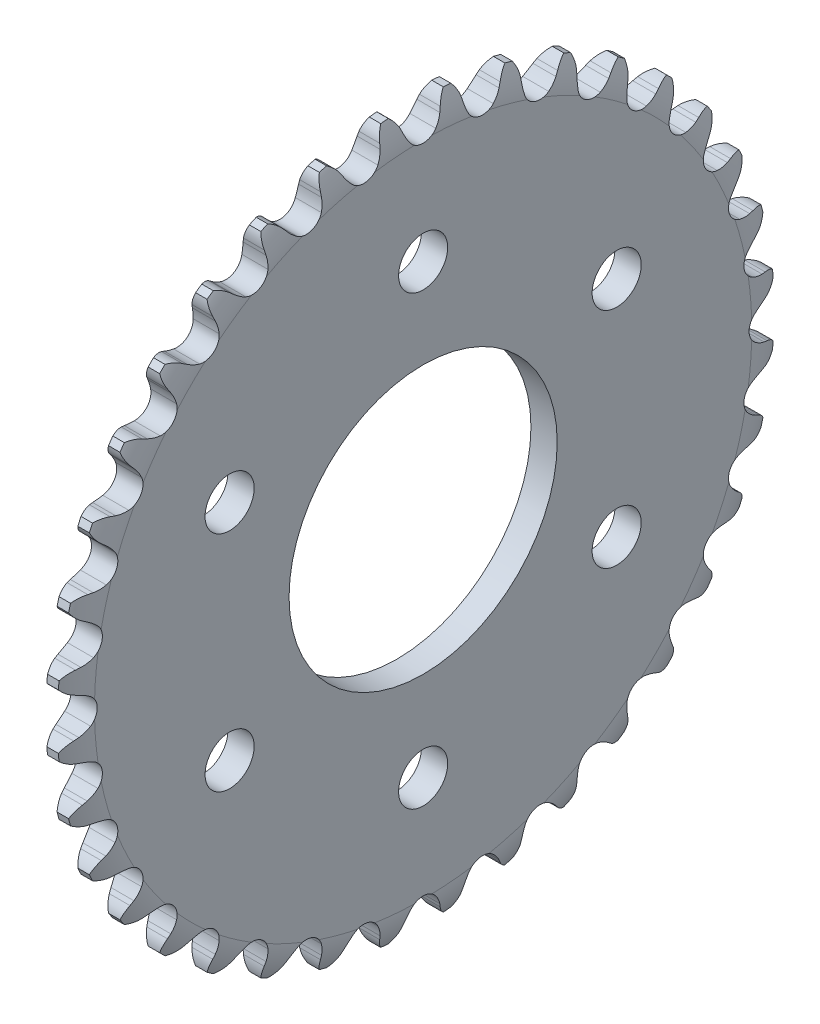
from build123d import *

# Parameters (mm, degrees)
TOOTHCUT_DEPTH    = 55.089015361
TEETHCUTS_COUNT   = 36
TEETHCUTS_ANGLE   = 350
BORSKE_R          = 11.1125
BORE_DEPTH        = 50.8000508
EXTRUDE1_DEPTH    = 54.930466244
CIRPATTERN1_COUNT = 6
SKETCH2_R         = 14.2875
EXTRUDE2_DEPTH    = 54.930466244


with BuildPart() as part:
    # BasProSke → Base-Revolve (revolve)
    with BuildSketch(Plane(origin=(0, 0, 0), x_dir=(1, 0, 0), z_dir=(0, 1, 0))):
        with BuildLine():
            Line((0, 0), (0, 35.020416103))
            ThreePointArc((0, 35.020416103), (0.199787117, 36.656006498), (0.7874, 38.195416103))
            Line((0.7874, 38.195416103), (2.01295, 38.195416103))
            ThreePointArc((2.01295, 38.195416103), (2.600562883, 36.656006498), (2.80035, 35.020416103))
            Line((2.80035, 35.020416103), (2.80035, 0))
            Line((2.80035, 0), (0, 0))
        make_face()
    revolve(axis=Axis((-10, 0, 0), (1, 0, 0)))

    # TooCutSke → ToothCut (cut, through all)
    with BuildSketch(Plane(origin=(0, 0, 0), x_dir=(0, 0, -1), z_dir=(1, 0, 0))):
        with BuildLine():
            Line((1.95260897, 36.506681138), (2.113680484, 36.943937289))
            ThreePointArc((2.113680484, 36.943937289), (3.086471, 38.204095647), (4.60520885, 38.681333339))
            ThreePointArc((4.60520885, 38.681333339), (0, 38.954505483), (-4.60520885, 38.681333339))
            ThreePointArc((-4.60520885, 38.681333339), (-3.086471, 38.204095647), (-2.113680484, 36.943937289))
            Line((-2.113680484, 36.943937289), (-1.95260897, 36.506681138))
            ThreePointArc((-1.95260897, 36.506681138), (-1.696264974, 35.939821649), (-1.361487812, 35.415449475))
            ThreePointArc((-1.361487812, 35.415449475), (0, 34.731684597), (1.361487812, 35.415449475))
            ThreePointArc((1.361487812, 35.415449475), (1.696264974, 35.939821649), (1.95260897, 36.506681138))
        make_face()
    toothcut = extrude(amount=TOOTHCUT_DEPTH, mode=Mode.SUBTRACT)

    # TeethCuts: ToothCut ×36 about axis
    teethcuts_axis = Axis((-10, 0, 0), (1, 0, 0))
    for i in range(1, TEETHCUTS_COUNT):
        add(toothcut.rotate(teethcuts_axis, i * TEETHCUTS_ANGLE / (TEETHCUTS_COUNT - 1)), mode=Mode.SUBTRACT)

    # BorSke → Bore (cut, symmetric)
    with BuildSketch(Plane(origin=(0, 0, 0), x_dir=(0, 0, -1), z_dir=(1, 0, 0))):
        Circle(BORSKE_R)
    extrude(amount=BORE_DEPTH, both=True, mode=Mode.SUBTRACT)

    # Sketch1 → Extrude1 (cut, through all)
    with BuildSketch(Plane(origin=(2.80035, 0, 0), x_dir=(0, 0, -1), z_dir=(1, 0, 0))):
        with BuildLine():
            ThreePointArc((2.6162, 23.8125), (-0.071885435, 26.427712214), (-2.612249602, 23.668783413))
            ThreePointArc((-2.612249602, 23.668783413), (0, 21.1963), (2.612249602, 23.668783413))
            ThreePointArc((2.612249602, 23.668783413), (2.615212214, 23.740614565), (2.6162, 23.8125))
        make_face()
    extrude1 = extrude(amount=-EXTRUDE1_DEPTH, mode=Mode.SUBTRACT)

    # CirPattern1: Extrude1 ×6 about axis
    cirpattern1_axis = Axis((2.80035, 0, 0), (1, 0, 0))
    for i in range(1, CIRPATTERN1_COUNT):
        add(extrude1.rotate(cirpattern1_axis, i * 360 / CIRPATTERN1_COUNT), mode=Mode.SUBTRACT)

    # Sketch2 → Extrude2 (cut, through all)
    with BuildSketch(Plane(origin=(2.80035, 0, 0), x_dir=(0, 0, -1), z_dir=(1, 0, 0))):
        Circle(SKETCH2_R)
    extrude(amount=-EXTRUDE2_DEPTH, mode=Mode.SUBTRACT)


solid = part.part
